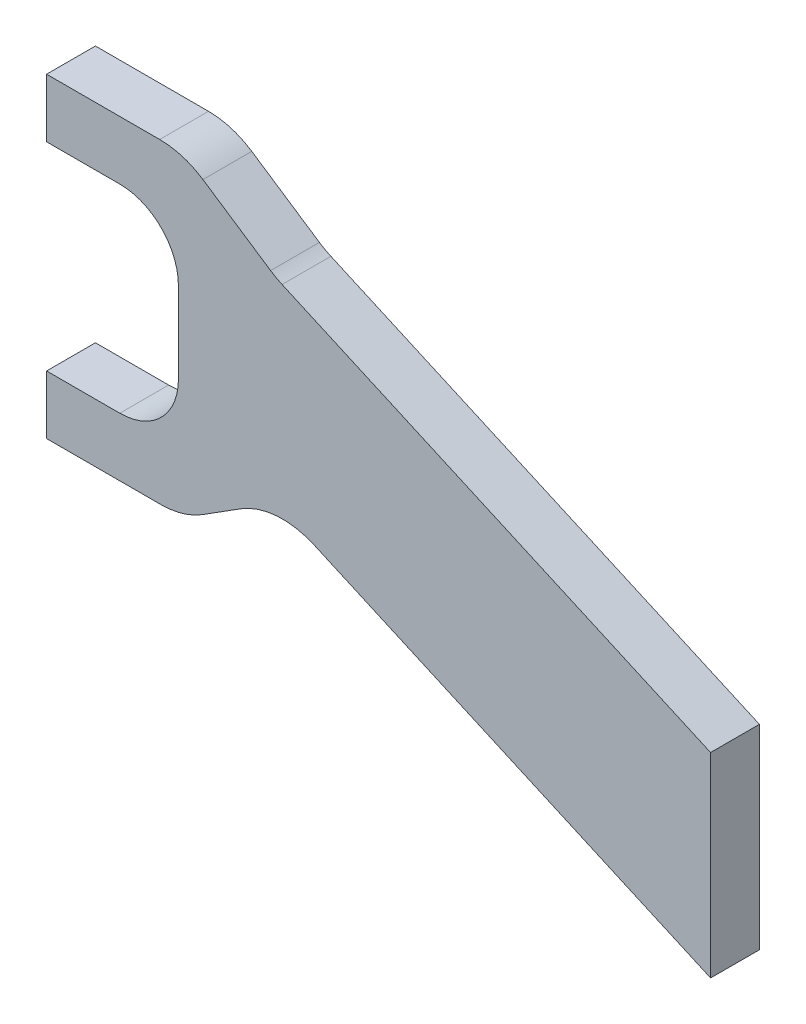
from build123d import *

# Parameters (mm, degrees)
BOSS_EXTRUDE1_DEPTH = 0.125
FILLET1_R           = 0.3
FILLET2_R           = 0.4


with BuildPart() as part:
    # frame_outline → Boss-Extrude1 (new, symmetric)
    with BuildSketch(Plane.XY):
        Polygon((0, 1.616), (0, 1.316), (0.675, 1.316), (0.675, 0.3), (0, 0.3), (0, 0), (0.7, 0), (1.175, 0.3), (3.4, -0.692), (3.4, 0.308), (1.175, 1.3), (0.7, 1.616), align=None)
    extrude(amount=BOSS_EXTRUDE1_DEPTH, both=True)

    # Fillet1
    fillet1_edges = [part.edges().sort_by_distance(p)[0] for p in [
        (0.675, 0.3, 0),
        (0.675, 1.316, 0),
    ]]
    fillet(fillet1_edges, radius=FILLET1_R)

    # Fillet2
    fillet2_edges = [part.edges().sort_by_distance(p)[0] for p in [
        (0.7, 0, 0),
        (1.175, 0.3, 0),
        (1.175, 1.3, 0),
        (0.7, 1.616, 0),
    ]]
    fillet(fillet2_edges, radius=FILLET2_R)


solid = part.part
